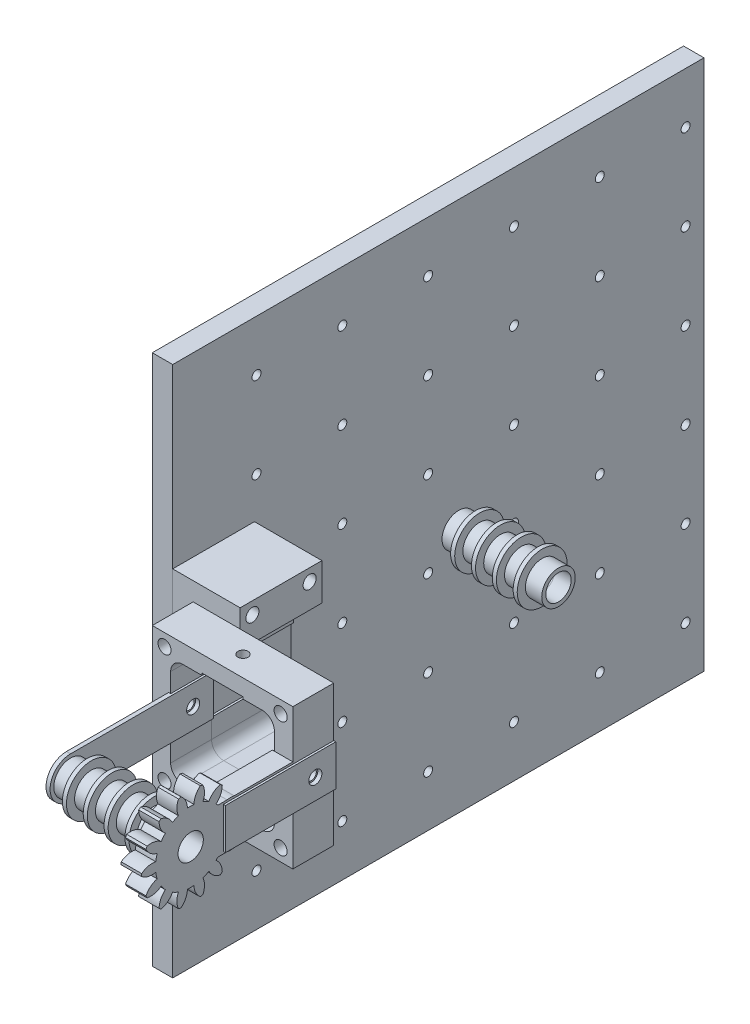
from build123d import *
from build123d.topology import SkipClean

# Parameters (mm, degrees)
BASPROSKE_W              = 5
BASPROSKE_H              = 12
TOOTHCUT_DEPTH           = 18.691806013
TEETHCUTS_COUNT          = 14
TEETHCUTS_ANGLE          = 334.285714286
BORSKE_R                 = 3.1
BORE_DEPTH               = 50.0000508
SKETCH_2_W               = 20
SKETCH_2_H               = 11
EXTRUDE_1_DEPTH          = 5
SKETCH_3_W               = 17
SKETCH_3_H               = 10
CUT_EXTRUDE_1_DEPTH      = 0.5
SKETCH_5_W               = 10
SKETCH_5_H               = 10
SKETCH_5_W_2             = 8
SKETCH_5_H_2             = 8
EXTRUDE_2_DEPTH          = 22
SKETCH_12_W              = 9
SKETCH_12_H              = 10
CUT_EXTRUDE_4_DEPTH      = 46.963971628
CUT_EXTRUDE_2_DEPTH      = 33.690773741
CUT_EXTRUDE_2_DEPTH_BACK = 33.690773741
SKETCH_4_R               = 1.25
SKETCH_7_R               = 4.1
SKETCH_7_R_2             = 3.1
EXTRUDE_3_DEPTH          = 4
PATTERN_LINEAR_1_COUNT   = 5
PATTERN_LINEAR_1_PITCH   = 5.1
SKETCH_14_R              = 3.1
EXTRUDE_5_DEPTH          = 1
SKETCH_15_W              = 34.4
SKETCH_15_H              = 34.4
SKETCH_15_R              = 1.6
EXTRUDE_6_DEPTH          = 5
SKETCH_17_R              = 6.1
SKETCH_17_R_2            = 3.1
EXTRUDE_8_DEPTH          = 1
PATTERN_LINEAR_3_COUNT   = 4
PATTERN_LINEAR_3_PITCH   = 5.1
PATTERN_LINEAR_2_COUNT   = 2
PATTERN_LINEAR_2_PITCH   = 100
MOVE_BODY_2_ANGLE        = 180
MOVE_BODY_2_2_ANGLE      = 180
MOVE_BODY_2_3_ANGLE      = 180
MOVE_BODY_2_4_ANGLE      = 180
MOVE_BODY_2_5_ANGLE      = 180
MOVE_BODY_2_6_ANGLE      = 180
MOVE_BODY_2_7_ANGLE      = 180
MOVE_BODY_2_8_ANGLE      = 180
MOVE_BODY_2_9_ANGLE      = 180
MOVE_BODY_2_10_ANGLE     = 180
MOVE_BODY_2_11_ANGLE     = 180
MOVE_BODY_2_12_ANGLE     = 180
MOVE_BODY_2_13_ANGLE     = 180
CUT_EXTRUDE_5_DEPTH      = 55.236980004
CUT_EXTRUDE_5_DEPTH_BACK = 55.236980004
SKETCH_16_W              = 10
SKETCH_16_H              = 1
SKETCH_16_W_2            = 1
SKETCH_16_H_2            = 10
EXTRUDE_START            = -5
EXTRUDE_7_OUTLINE_W      = 1
EXTRUDE_7_OUTLINE_H      = 10
EXTRUDE_7_DEPTH          = 5
EXTRUDE_7_2_OUTLINE_W    = 1
EXTRUDE_7_2_OUTLINE_H    = 10
EXTRUDE_7_2_DEPTH        = 5
EXTRUDE_7_3_OUTLINE_W    = 10
EXTRUDE_7_3_OUTLINE_H    = 1
EXTRUDE_7_3_DEPTH        = 5
EXTRUDE_7_4_OUTLINE_W    = 10
EXTRUDE_7_4_OUTLINE_H    = 1
EXTRUDE_7_4_DEPTH        = 5
SKETCH_21_R              = 1.25
CUT_EXTRUDE_6_DEPTH      = 82.946934049
SKETCH_22_R              = 1.25
CUT_EXTRUDE_7_DEPTH      = 86.243005578
SKETCH_23_R              = 1.6
CUT_EXTRUDE_8_DEPTH      = 82.946934049
SKETCH_24_R              = 1.6
CUT_EXTRUDE_9_DEPTH      = 86.243005578
SKETCH_30_R              = 1.6
EXTRUDE_10_DEPTH         = 20
SKETCH_31_R              = 1.6
CUT_EXTRUDE_13_DEPTH     = 72.329517032
SKETCH_32_W              = 130
SKETCH_32_H              = 130
EXTRUDE_11_DEPTH         = 5
SKETCH_33_R              = 1.1
CUT_EXTRUDE_14_DEPTH     = 5


with BuildPart() as part:
    # BasProSke → Base-Revolve (revolve)
    with BuildSketch(Plane(origin=(0, 0, 0), x_dir=(1, 0, 0), z_dir=(0, 1, 0)), mode=Mode.PRIVATE) as base_revolve_sk:
        with Locations((2.5, 6)):
            Rectangle(BASPROSKE_W, BASPROSKE_H)
    revolve(base_revolve_sk.sketch.rotate(Axis((-10, 0, 0), (1, 0, 0)), 180), axis=Axis((-10, 0, 0), (1, 0, 0)))

    # TooCutSke → ToothCut (cut, through all)
    with BuildSketch(Plane(origin=(0, 0, 0), x_dir=(0, 0, -1), z_dir=(1, 0, 0))):
        with BuildLine():
            ThreePointArc((0.804845511, 8.586361261), (0, 8.624), (-0.804845511, 8.586361261))
            ThreePointArc((-0.804845511, 8.586361261), (-1.237812142, 10.362618414), (-2.384428228, 11.78663426))
            ThreePointArc((-2.384428228, 11.78663426), (0, 12.0254), (2.384428228, 11.78663426))
            ThreePointArc((2.384428228, 11.78663426), (1.237812142, 10.362618414), (0.804845511, 8.586361261))
        make_face()
    toothcut = extrude(amount=TOOTHCUT_DEPTH, mode=Mode.SUBTRACT)

    # TeethCuts: ToothCut ×14 about axis
    teethcuts_axis = Axis((-10, 0, 0), (1, 0, 0))
    for i in range(1, TEETHCUTS_COUNT):
        add(toothcut.rotate(teethcuts_axis, i * TEETHCUTS_ANGLE / (TEETHCUTS_COUNT - 1)), mode=Mode.SUBTRACT)

    # BorSke → Bore (cut, symmetric)
    with BuildSketch(Plane(origin=(0, 0, 0), x_dir=(0, 0, -1), z_dir=(1, 0, 0))):
        with Locations(Location((0, 0, 0), (0, 0, 180))):
            Circle(BORSKE_R)
    extrude(amount=BORE_DEPTH, both=True, mode=Mode.SUBTRACT)

    # ｽｹｯﾁ2 → ﾎﾞｽ - 押し出し1 (add)
    with BuildSketch(Plane(origin=(5, 0, 0), x_dir=(0, 0, -1), z_dir=(1, 0, 0))):
        with Locations((15, 0)):
            Rectangle(SKETCH_2_W, SKETCH_2_H)
    extrude(amount=-EXTRUDE_1_DEPTH)

    # ｽｹｯﾁ3 → ｶｯﾄ - 押し出し1 (cut)
    with BuildSketch(Plane(origin=(5, 0, 0), x_dir=(0, 0, -1), z_dir=(1, 0, 0))):
        with Locations((16.5, 0)):
            Rectangle(SKETCH_3_W, SKETCH_3_H)
    extrude(amount=-CUT_EXTRUDE_1_DEPTH, mode=Mode.SUBTRACT)

    # ｽｹｯﾁ4 → ｶｯﾄ - 押し出し2 (cut, two sides: drawn at the far end of the back side and taken through both)
    with BuildSketch(Plane.ZY.offset(-CUT_EXTRUDE_2_DEPTH_BACK)):
        with Locations(Location((-21, 0, 0), (0, 0, 180))):
            Circle(SKETCH_4_R)
        with Locations(Location((-13, 0, 0), (0, 0, 180))):
            Circle(SKETCH_4_R)
    extrude(amount=CUT_EXTRUDE_2_DEPTH + CUT_EXTRUDE_2_DEPTH_BACK, mode=Mode.SUBTRACT)


with BuildPart() as body_2:
    # ｽｹｯﾁ5 → ﾎﾞｽ - 押し出し2 (new body)
    with BuildSketch(Plane(origin=(0, 0, -8), x_dir=(-1, 0, 0), z_dir=(0, 0, -1))):
        with Locations((-9.5, 0)):
            Rectangle(SKETCH_5_W, SKETCH_5_H)
        with Locations((-9.5, 0)):
            Rectangle(SKETCH_5_W_2, SKETCH_5_H_2, mode=Mode.SUBTRACT)
    extrude(amount=EXTRUDE_2_DEPTH)

    # ｽｹｯﾁ12 → ｶｯﾄ - 押し出し4 (cut, through all)
    with BuildSketch(Plane(origin=(0, 0, -30), x_dir=(-1, 0, 0), z_dir=(0, 0, -1))):
        with Locations((-10, 0)):
            Rectangle(SKETCH_12_W, SKETCH_12_H)
    extrude(amount=-CUT_EXTRUDE_4_DEPTH, mode=Mode.SUBTRACT)


with BuildPart() as body_3:
    # ｽｹｯﾁ7 → ﾎﾞｽ - 押し出し3 (new body)
    with BuildSketch(Plane.ZY):
        Circle(SKETCH_7_R)
        Circle(SKETCH_7_R_2, mode=Mode.SUBTRACT)
    extrude(amount=EXTRUDE_3_DEPTH)


with BuildPart() as pattern_linear_1_1:
    # 直線ﾊﾟﾀｰﾝ1: pattern copy
    add(body_3.part.moved(Location(Vector(-1, 0, 0) * (1 * PATTERN_LINEAR_1_PITCH))))


with BuildPart() as pattern_linear_1_2:
    # 直線ﾊﾟﾀｰﾝ1: pattern copy
    add(body_3.part.moved(Location(Vector(-1, 0, 0) * (2 * PATTERN_LINEAR_1_PITCH))))


with BuildPart() as pattern_linear_1_3:
    # 直線ﾊﾟﾀｰﾝ1: pattern copy
    add(body_3.part.moved(Location(Vector(-1, 0, 0) * (3 * PATTERN_LINEAR_1_PITCH))))


with BuildPart() as pattern_linear_1_4:
    # 直線ﾊﾟﾀｰﾝ1: pattern copy
    add(body_3.part.moved(Location(Vector(-1, 0, 0) * (4 * PATTERN_LINEAR_1_PITCH))))


with BuildPart() as body_8:
    # ｽｹｯﾁ14 → ﾎﾞｽ - 押し出し5 (new body)
    with BuildSketch(Plane.ZY.offset(24.4)):
        with BuildLine():
            Line((-30, 5), (0, 5))
            ThreePointArc((0, 5), (5, 0), (0, -5))
            Line((0, -5), (-30, -5))
            Line((-30, -5), (-30, 5))
        make_face()
        Circle(SKETCH_14_R, mode=Mode.SUBTRACT)
    extrude(amount=EXTRUDE_5_DEPTH)


with BuildPart() as body_9:
    # ｽｹｯﾁ15 → ﾎﾞｽ - 押し出し6 (new body)
    with BuildSketch(Plane(origin=(0, 0, -30), x_dir=(-1, 0, 0), z_dir=(0, 0, -1))):
        with Locations((12.2, 0)):
            Rectangle(SKETCH_15_W, SKETCH_15_H)
        with Locations(Location((26.4, 14.2, 0), (0, 0, 90))):
            Circle(SKETCH_15_R, mode=Mode.SUBTRACT)
        with Locations(Location((26.4, -14.2, 0), (0, 0, 90))):
            Circle(SKETCH_15_R, mode=Mode.SUBTRACT)
        with Locations(Location((-2, -14.2, 0), (0, 0, 90))):
            Circle(SKETCH_15_R, mode=Mode.SUBTRACT)
        with Locations(Location((-2, 14.2, 0), (0, 0, 90))):
            Circle(SKETCH_15_R, mode=Mode.SUBTRACT)
        with BuildLine():
            Line((21.9, -12.7), (2.5, -12.7))
            ThreePointArc((2.5, -12.7), (0.378679656, -11.821320344), (-0.5, -9.7))
            Line((-0.5, -9.7), (-0.5, 9.7))
            ThreePointArc((-0.5, 9.7), (0.378679656, 11.821320344), (2.5, 12.7))
            Line((2.5, 12.7), (21.9, 12.7))
            ThreePointArc((21.9, 12.7), (24.021320344, 11.821320344), (24.9, 9.7))
            Line((24.9, 9.7), (24.9, -9.7))
            ThreePointArc((24.9, -9.7), (24.021320344, -11.821320344), (21.9, -12.7))
        make_face(mode=Mode.SUBTRACT)
    extrude(amount=-EXTRUDE_6_DEPTH)


with BuildPart() as body_10:
    # ｽｹｯﾁ17 → ﾎﾞｽ - 押し出し8 (new body)
    with BuildSketch(Plane.ZY.offset(4)):
        Circle(SKETCH_17_R)
        Circle(SKETCH_17_R_2, mode=Mode.SUBTRACT)
    extrude(amount=EXTRUDE_8_DEPTH)


with BuildPart() as pattern_linear_3_1:
    # 直線ﾊﾟﾀｰﾝ3: pattern copy
    add(body_10.part.moved(Location(Vector(-1, 0, 0) * (1 * PATTERN_LINEAR_3_PITCH))))


with BuildPart() as pattern_linear_3_2:
    # 直線ﾊﾟﾀｰﾝ3: pattern copy
    add(body_10.part.moved(Location(Vector(-1, 0, 0) * (2 * PATTERN_LINEAR_3_PITCH))))


with BuildPart() as pattern_linear_3_3:
    # 直線ﾊﾟﾀｰﾝ3: pattern copy
    add(body_10.part.moved(Location(Vector(-1, 0, 0) * (3 * PATTERN_LINEAR_3_PITCH))))


with BuildPart() as pattern_linear_2_1:
    # 直線ﾊﾟﾀｰﾝ2: pattern copy
    add(body_10.part.moved(Location(Vector(0, 0, -1) * (1 * PATTERN_LINEAR_2_PITCH))))


with BuildPart() as pattern_linear_2_2:
    # 直線ﾊﾟﾀｰﾝ2: pattern copy
    add(pattern_linear_3_1.part.moved(Location(Vector(0, 0, -1) * (1 * PATTERN_LINEAR_2_PITCH))))


with BuildPart() as pattern_linear_2_3:
    # 直線ﾊﾟﾀｰﾝ2: pattern copy
    add(pattern_linear_3_2.part.moved(Location(Vector(0, 0, -1) * (1 * PATTERN_LINEAR_2_PITCH))))


with BuildPart() as pattern_linear_2_4:
    # 直線ﾊﾟﾀｰﾝ2: pattern copy
    add(pattern_linear_3_3.part.moved(Location(Vector(0, 0, -1) * (1 * PATTERN_LINEAR_2_PITCH))))


with BuildPart() as pattern_linear_2_5:
    # 直線ﾊﾟﾀｰﾝ2: pattern copy
    add(body_3.part.moved(Location(Vector(0, 0, -1) * (1 * PATTERN_LINEAR_2_PITCH))))


with BuildPart() as pattern_linear_2_6:
    # 直線ﾊﾟﾀｰﾝ2: pattern copy
    add(pattern_linear_1_1.part.moved(Location(Vector(0, 0, -1) * (1 * PATTERN_LINEAR_2_PITCH))))


with BuildPart() as pattern_linear_2_7:
    # 直線ﾊﾟﾀｰﾝ2: pattern copy
    add(body_9.part.moved(Location(Vector(0, 0, -1) * (1 * PATTERN_LINEAR_2_PITCH))))


with BuildPart() as pattern_linear_2_8:
    # 直線ﾊﾟﾀｰﾝ2: pattern copy
    add(pattern_linear_1_2.part.moved(Location(Vector(0, 0, -1) * (1 * PATTERN_LINEAR_2_PITCH))))


with BuildPart() as pattern_linear_2_9:
    # 直線ﾊﾟﾀｰﾝ2: pattern copy
    add(pattern_linear_1_3.part.moved(Location(Vector(0, 0, -1) * (1 * PATTERN_LINEAR_2_PITCH))))


with BuildPart() as pattern_linear_2_10:
    # 直線ﾊﾟﾀｰﾝ2: pattern copy
    add(body_2.part.moved(Location(Vector(0, 0, -1) * (1 * PATTERN_LINEAR_2_PITCH))))


with BuildPart() as pattern_linear_2_11:
    # 直線ﾊﾟﾀｰﾝ2: pattern copy
    add(part.part.moved(Location(Vector(0, 0, -1) * (1 * PATTERN_LINEAR_2_PITCH))))


with BuildPart() as pattern_linear_2_12:
    # 直線ﾊﾟﾀｰﾝ2: pattern copy
    add(pattern_linear_1_4.part.moved(Location(Vector(0, 0, -1) * (1 * PATTERN_LINEAR_2_PITCH))))


with BuildPart() as pattern_linear_2_13:
    # 直線ﾊﾟﾀｰﾝ2: pattern copy
    add(body_8.part.moved(Location(Vector(0, 0, -1) * (1 * PATTERN_LINEAR_2_PITCH))))


with BuildPart() as pattern_linear_2_2_1:
    # Move Body 2: read off the stored shape, not the designer's step
    # Move Body 2: moved
    add(pattern_linear_2_2.part.moved(Location((12.2, 12.2, 160))).rotate(Axis((0, 0, 0), (0.7071067812, -0.7071067812, 0)), MOVE_BODY_2_ANGLE))


with BuildPart() as pattern_linear_2_12_1:
    # Move Body 2 2: moved
    add(pattern_linear_2_12.part.moved(Location((12.2, 12.2, 160))).rotate(Axis((0, 0, 0), (0.7071067812, -0.7071067812, 0)), MOVE_BODY_2_2_ANGLE))


with BuildPart() as pattern_linear_2_9_1:
    # Move Body 2 3: moved
    add(pattern_linear_2_9.part.moved(Location((12.2, 12.2, 160))).rotate(Axis((0, 0, 0), (0.7071067812, -0.7071067812, 0)), MOVE_BODY_2_3_ANGLE))


with BuildPart() as pattern_linear_2_11_1:
    # Move Body 2 4: moved
    add(pattern_linear_2_11.part.moved(Location((12.2, 12.2, 160))).rotate(Axis((0, 0, 0), (0.7071067812, -0.7071067812, 0)), MOVE_BODY_2_4_ANGLE))


with BuildPart() as pattern_linear_2_3_1:
    # Move Body 2 5: moved
    add(pattern_linear_2_3.part.moved(Location((12.2, 12.2, 160))).rotate(Axis((0, 0, 0), (0.7071067812, -0.7071067812, 0)), MOVE_BODY_2_5_ANGLE))


with BuildPart() as pattern_linear_2_4_1:
    # Move Body 2 6: moved
    add(pattern_linear_2_4.part.moved(Location((12.2, 12.2, 160))).rotate(Axis((0, 0, 0), (0.7071067812, -0.7071067812, 0)), MOVE_BODY_2_6_ANGLE))


with BuildPart() as pattern_linear_2_5_1:
    # Move Body 2 7: moved
    add(pattern_linear_2_5.part.moved(Location((12.2, 12.2, 160))).rotate(Axis((0, 0, 0), (0.7071067812, -0.7071067812, 0)), MOVE_BODY_2_7_ANGLE))


with BuildPart() as pattern_linear_2_8_1:
    # Move Body 2 8: moved
    add(pattern_linear_2_8.part.moved(Location((12.2, 12.2, 160))).rotate(Axis((0, 0, 0), (0.7071067812, -0.7071067812, 0)), MOVE_BODY_2_8_ANGLE))


with BuildPart() as pattern_linear_2_6_1:
    # Move Body 2 9: moved
    add(pattern_linear_2_6.part.moved(Location((12.2, 12.2, 160))).rotate(Axis((0, 0, 0), (0.7071067812, -0.7071067812, 0)), MOVE_BODY_2_9_ANGLE))


with BuildPart() as pattern_linear_2_1_1:
    # Move Body 2 10: moved
    add(pattern_linear_2_1.part.moved(Location((12.2, 12.2, 160))).rotate(Axis((0, 0, 0), (0.7071067812, -0.7071067812, 0)), MOVE_BODY_2_10_ANGLE))


with BuildPart() as pattern_linear_2_13_1:
    # Move Body 2 11: moved
    add(pattern_linear_2_13.part.moved(Location((12.2, 12.2, 160))).rotate(Axis((0, 0, 0), (0.7071067812, -0.7071067812, 0)), MOVE_BODY_2_11_ANGLE))

    # Extrude 7 3 outline → Extrude 7 3 (add)
    with BuildSketch(Plane.XY.offset(-30)):
        with Locations((-12.2, 12.7)):
            Rectangle(EXTRUDE_7_3_OUTLINE_W, EXTRUDE_7_3_OUTLINE_H)
    extrude(amount=EXTRUDE_7_3_DEPTH)


with BuildPart() as pattern_linear_2_10_1:
    # Move Body 2 12: moved
    add(pattern_linear_2_10.part.moved(Location((12.2, 12.2, 160))).rotate(Axis((0, 0, 0), (0.7071067812, -0.7071067812, 0)), MOVE_BODY_2_12_ANGLE))

    # Extrude 7 4 outline → Extrude 7 4 (add)
    with BuildSketch(Plane.XY.offset(-30)):
        with Locations((-12.2, -17.2)):
            Rectangle(EXTRUDE_7_4_OUTLINE_W, EXTRUDE_7_4_OUTLINE_H)
    extrude(amount=EXTRUDE_7_4_DEPTH)


with BuildPart() as pattern_linear_2_7_1:
    # Move Body 2 13: moved
    add(pattern_linear_2_7.part.moved(Location((12.2, 12.2, 160))).rotate(Axis((0, 0, 0), (0.7071067812, -0.7071067812, 0)), MOVE_BODY_2_13_ANGLE))


with BuildPart() as cut_extrude_5_tool:
    # ｽｹｯﾁ16 → ｶｯﾄ - 押し出し5 (new, two sides: drawn at the far end of the back side and taken through both)
    with BuildSketch(Plane.XY.offset(-30).offset(-CUT_EXTRUDE_5_DEPTH_BACK)):
        with Locations((-12.2, -17.2)):
            Rectangle(SKETCH_16_W, SKETCH_16_H)
        with Locations((5, 0)):
            Rectangle(SKETCH_16_W_2, SKETCH_16_H_2)
        with Locations((-12.2, 12.7)):
            Rectangle(SKETCH_16_W, SKETCH_16_H)
        with Locations((-24.9, 0)):
            Rectangle(SKETCH_16_W_2, SKETCH_16_H_2)
    extrude(amount=CUT_EXTRUDE_5_DEPTH + CUT_EXTRUDE_5_DEPTH_BACK)


with BuildPart() as body_9_1:
    add(body_9.part)

    # ｶｯﾄ - 押し出し5: cut by cut_extrude_5_tool
    add(cut_extrude_5_tool.part, mode=Mode.SUBTRACT)


with BuildPart() as pattern_linear_2_7_2:
    add(pattern_linear_2_7_1.part)

    # ｶｯﾄ - 押し出し5: cut by cut_extrude_5_tool
    add(cut_extrude_5_tool.part, mode=Mode.SUBTRACT)


with BuildPart() as body_9_2:
    add(body_9_1.part)

    # Combine 1: union 直線ﾊﾟﾀｰﾝ2_7
    add(pattern_linear_2_7_2.part)

    # ｽｹｯﾁ21 → ｶｯﾄ - 押し出し6 (cut, through all)
    with SkipClean():  # the faces are left unmerged after this step: merging them gives an invalid solid
        with BuildSketch(Plane.ZY.offset(29.4)):
            with Locations((-30, 0)):
                Circle(SKETCH_21_R)
        extrude(amount=-CUT_EXTRUDE_6_DEPTH, mode=Mode.SUBTRACT)

    # ｽｹｯﾁ22 → ｶｯﾄ - 押し出し7 (cut, through all)
    with SkipClean():  # the faces are left unmerged after this step: merging them gives an invalid solid
        with BuildSketch(Plane.XZ.offset(17.7)):
            with Locations(Location((-12.2, -30, 0), (0, 0, 270))):
                Circle(SKETCH_22_R)
        extrude(amount=-CUT_EXTRUDE_7_DEPTH, mode=Mode.SUBTRACT)


with BuildPart() as body_8_1:
    add(body_8.part)

    # ﾎﾞｽ - 押し出し7: read off the stored shape, not the designer's step
    # ﾎﾞｽ - 押し出し7 outline → ﾎﾞｽ - 押し出し7 (add)
    with BuildSketch(Plane.XY.offset(-30).offset(EXTRUDE_START)):
        with Locations((-24.9, 0)):
            Rectangle(EXTRUDE_7_OUTLINE_W, EXTRUDE_7_OUTLINE_H)
    extrude(amount=EXTRUDE_7_DEPTH)


with BuildPart() as body_2_1:
    add(body_2.part)

    # Extrude 7 2 outline → Extrude 7 2 (add)
    with BuildSketch(Plane.XY.offset(-30).offset(EXTRUDE_START)):
        with Locations((5, 0)):
            Rectangle(EXTRUDE_7_2_OUTLINE_W, EXTRUDE_7_2_OUTLINE_H)
    extrude(amount=EXTRUDE_7_2_DEPTH)


with BuildPart() as cut_extrude_8_tool:
    # ｽｹｯﾁ23 → ｶｯﾄ - 押し出し8 (new, through all)
    with BuildSketch(Plane.ZY.offset(29.4)):
        with Locations(Location((-30, 0, 0), (0, 0, 180))):
            Circle(SKETCH_23_R)
    extrude(amount=-CUT_EXTRUDE_8_DEPTH)


with BuildPart() as body_2_2:
    add(body_2_1.part)

    # ｶｯﾄ - 押し出し8: cut by cut_extrude_8_tool
    add(cut_extrude_8_tool.part, mode=Mode.SUBTRACT)


with BuildPart() as body_8_2:
    add(body_8_1.part)

    # ｶｯﾄ - 押し出し8: cut by cut_extrude_8_tool
    add(cut_extrude_8_tool.part, mode=Mode.SUBTRACT)


with BuildPart() as cut_extrude_9_tool:
    # ｽｹｯﾁ24 → ｶｯﾄ - 押し出し9 (new, through all)
    with BuildSketch(Plane(origin=(0, 17.2, 0), x_dir=(1, 0, 0), z_dir=(0, 1, 0))):
        with Locations((-12.2, 30)):
            Circle(SKETCH_24_R)
    extrude(amount=-CUT_EXTRUDE_9_DEPTH)


with BuildPart() as pattern_linear_2_13_2:
    add(pattern_linear_2_13_1.part)

    # ｶｯﾄ - 押し出し9: cut by cut_extrude_9_tool
    add(cut_extrude_9_tool.part, mode=Mode.SUBTRACT)


with BuildPart() as pattern_linear_2_10_2:
    add(pattern_linear_2_10_1.part)

    # ｶｯﾄ - 押し出し9: cut by cut_extrude_9_tool
    add(cut_extrude_9_tool.part, mode=Mode.SUBTRACT)


with BuildPart() as body_14:
    # ｽｹｯﾁ30 → ﾎﾞｽ - 押し出し10 (new body)
    with BuildSketch(Plane(origin=(0, 0, -35), x_dir=(-1, 0, 0), z_dir=(0, 0, -1))):
        with BuildLine():
            Line((17.9, 21.7), (34.4, 21.7))
            Line((34.4, 21.7), (34.4, -21.7))
            Line((34.4, -21.7), (17.9, -21.7))
            Line((17.9, -21.7), (17.9, -12.7))
            Line((17.9, -12.7), (21.9, -12.7))
            ThreePointArc((21.9, -12.7), (24.021320344, -11.821320344), (24.9, -9.7))
            Line((24.9, -9.7), (24.9, -5))
            Line((24.9, -5), (25.4, -5))
            Line((25.4, -5), (25.4, 5))
            Line((25.4, 5), (24.9, 5))
            Line((24.9, 5), (24.9, 9.7))
            ThreePointArc((24.9, 9.7), (24.021320344, 11.821320344), (21.9, 12.7))
            Line((21.9, 12.7), (17.9, 12.7))
            Line((17.9, 12.7), (17.9, 21.7))
        make_face()
        with Locations((26.4, 14.2)):
            Circle(SKETCH_30_R, mode=Mode.SUBTRACT)
        with Locations((26.4, -14.2)):
            Circle(SKETCH_30_R, mode=Mode.SUBTRACT)
    extrude(amount=EXTRUDE_10_DEPTH)

    # ｽｹｯﾁ31 → ｶｯﾄ - 押し出し13 (cut, through all)
    with BuildSketch(Plane.ZY.offset(34.4)):
        with Locations((-52, 18.7)):
            Circle(SKETCH_31_R)
        with Locations((-38, 18.7)):
            Circle(SKETCH_31_R)
        with Locations((-38, -18.7)):
            Circle(SKETCH_31_R)
        with Locations((-52, -18.7)):
            Circle(SKETCH_31_R)
    extrude(amount=-CUT_EXTRUDE_13_DEPTH, mode=Mode.SUBTRACT)


with BuildPart() as body_15:
    # ｽｹｯﾁ32 → ﾎﾞｽ - 押し出し11 (new body)
    with BuildSketch(Plane.ZY.offset(34.4)):
        with Locations((-100, 0)):
            Rectangle(SKETCH_32_W, SKETCH_32_H)
    extrude(amount=EXTRUDE_11_DEPTH)

    # ｽｹｯﾁ33 → ｶｯﾄ - 押し出し14 (cut, symmetric)
    with BuildSketch(Plane(origin=(-34.4, 0, 0), x_dir=(0, 0, -1), z_dir=(1, 0, 0))):
        with Locations((118.5, -31.5)):
            Circle(SKETCH_33_R)
        with Locations((97.5, -31.5)):
            Circle(SKETCH_33_R)
        with Locations((97.5, -52.5)):
            Circle(SKETCH_33_R)
        with Locations((118.5, -52.5)):
            Circle(SKETCH_33_R)
        with Locations((160.5, -52.5)):
            Circle(SKETCH_33_R)
        with Locations((139.5, -52.5)):
            Circle(SKETCH_33_R)
        with Locations((139.5, -31.5)):
            Circle(SKETCH_33_R)
        with Locations((160.5, -31.5)):
            Circle(SKETCH_33_R)
        with Locations((160.5, 52.5)):
            Circle(SKETCH_33_R)
        with Locations((139.5, 52.5)):
            Circle(SKETCH_33_R)
        with Locations((160.5, 31.5)):
            Circle(SKETCH_33_R)
        with Locations((139.5, 31.5)):
            Circle(SKETCH_33_R)
        with Locations((118.5, 52.5)):
            Circle(SKETCH_33_R)
        with Locations((97.5, 52.5)):
            Circle(SKETCH_33_R)
        with Locations((118.5, 31.5)):
            Circle(SKETCH_33_R)
        with Locations((97.5, 31.5)):
            Circle(SKETCH_33_R)
        with Locations((97.5, -10.5)):
            Circle(SKETCH_33_R)
        with Locations((118.5, -10.5)):
            Circle(SKETCH_33_R)
        with Locations((139.5, -10.5)):
            Circle(SKETCH_33_R)
        with Locations((160.5, -10.5)):
            Circle(SKETCH_33_R)
        with Locations((160.5, 10.5)):
            Circle(SKETCH_33_R)
        with Locations((139.5, 10.5)):
            Circle(SKETCH_33_R)
        with Locations((118.5, 10.5)):
            Circle(SKETCH_33_R)
        with Locations((97.5, 10.5)):
            Circle(SKETCH_33_R)
        with Locations((76.5, -52.5)):
            Circle(SKETCH_33_R)
        with Locations((76.5, -31.5)):
            Circle(SKETCH_33_R)
        with Locations((76.5, -10.5)):
            Circle(SKETCH_33_R)
        with Locations((76.5, 10.5)):
            Circle(SKETCH_33_R)
        with Locations((76.5, 31.5)):
            Circle(SKETCH_33_R)
        with Locations((76.5, 52.5)):
            Circle(SKETCH_33_R)
        with Locations((55.5, -52.5)):
            Circle(SKETCH_33_R)
        with Locations((55.5, -31.5)):
            Circle(SKETCH_33_R)
        with Locations((55.5, -10.5)):
            Circle(SKETCH_33_R)
        with Locations((55.5, 10.5)):
            Circle(SKETCH_33_R)
        with Locations((55.5, 31.5)):
            Circle(SKETCH_33_R)
        with Locations((55.5, 52.5)):
            Circle(SKETCH_33_R)
    extrude(amount=CUT_EXTRUDE_14_DEPTH, both=True, mode=Mode.SUBTRACT)


with BuildPart() as body_16:
    # Move Body 3: read off the stored shape, not the designer's step
    # Move Body 3: copy of 直線ﾊﾟﾀｰﾝ1_4
    add(pattern_linear_1_4.part.moved(Location((15.4, 0, -100))))


with BuildPart() as body_17:
    # Move Body 3 2: copy of 直線ﾊﾟﾀｰﾝ3_3
    add(pattern_linear_3_3.part.moved(Location((10.3, 0, -100))))


with BuildPart() as body_18:
    # Move Body 3 3: copy of 直線ﾊﾟﾀｰﾝ1_4
    add(pattern_linear_1_4.part.moved(Location((10.3, 0, -100))))


with BuildPart() as body_19:
    # Move Body 3 4: copy of 直線ﾊﾟﾀｰﾝ3_3
    add(pattern_linear_3_3.part.moved(Location((5.2, 0, -100))))


with BuildPart() as body_20:
    # Move Body 3 5: copy of 直線ﾊﾟﾀｰﾝ1_4
    add(pattern_linear_1_4.part.moved(Location((5.2, 0, -100))))


with BuildPart() as body_21:
    # Move Body 3 6: copy of 直線ﾊﾟﾀｰﾝ3_3
    add(pattern_linear_3_3.part.moved(Location((0.1, 0, -100))))


with BuildPart() as body_22:
    # Move Body 3 7: copy of 直線ﾊﾟﾀｰﾝ1_4
    add(pattern_linear_1_4.part.moved(Location((0.1, 0, -100))))


with BuildPart() as body_23:
    # Move Body 3 8: copy of 直線ﾊﾟﾀｰﾝ3_3
    add(pattern_linear_3_3.part.moved(Location((-5, 0, -100))))


with BuildPart() as body_24:
    # Move Body 3 9: copy of 直線ﾊﾟﾀｰﾝ1_4
    add(pattern_linear_1_4.part.moved(Location((-5, 0, -100))))


solid = Compound([part.part, body_3.part, pattern_linear_1_1.part, pattern_linear_1_2.part, pattern_linear_1_3.part, pattern_linear_1_4.part, body_10.part, pattern_linear_3_1.part, pattern_linear_3_2.part, pattern_linear_3_3.part, body_9_2.part, body_2_2.part, body_8_2.part, body_14.part, body_15.part, body_16.part, body_17.part, body_18.part, body_19.part, body_20.part, body_21.part, body_22.part, body_23.part, body_24.part])
